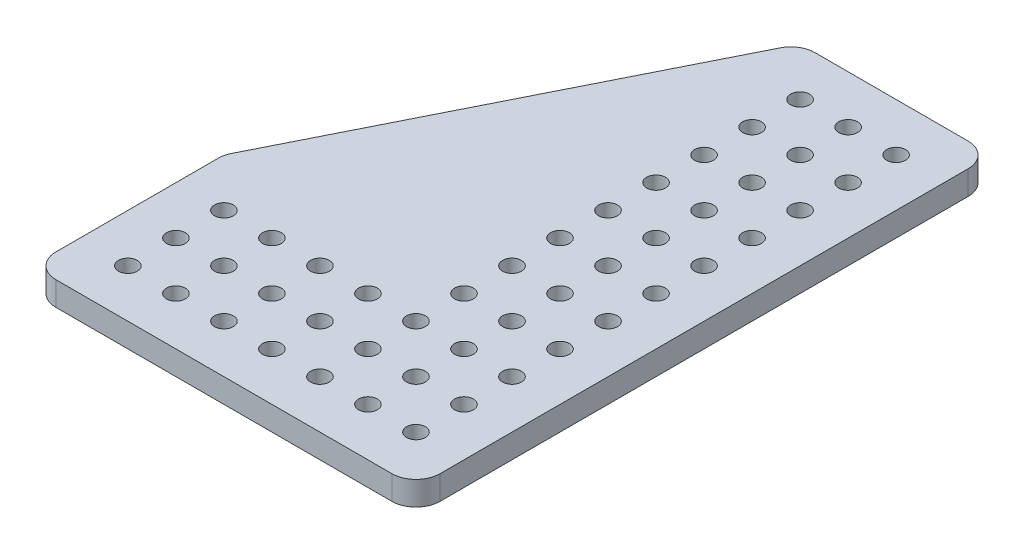
from build123d import *

# Parameters (mm, degrees)
BOSS_EXTRUDE1_DEPTH = 6.35
SKETCH2_R           = 2.4892
CUT_EXTRUDE1_DEPTH  = 184.272045059
FILLET1_R           = 6.35


with BuildPart() as part:
    # Sketch1 → Boss-Extrude1 (new body)
    with BuildSketch(Plane(origin=(0, 0, 0), x_dir=(1, 0, 0), z_dir=(0, 1, 0))):
        Polygon((0, 50.8), (50.8, 152.4), (101.6, 152.4), (101.6, 0), (0, 0), align=None)
    extrude(amount=BOSS_EXTRUDE1_DEPTH)

    # Sketch2 → Cut-Extrude1 (cut, through all)
    with BuildSketch(Plane(origin=(0, 6.35, 0), x_dir=(1, 0, 0), z_dir=(0, 1, 0))):
        with Locations((88.9, 12.7)):
            Circle(SKETCH2_R)
        with Locations((76.2, 12.7)):
            Circle(SKETCH2_R)
        with Locations((63.5, 12.7)):
            Circle(SKETCH2_R)
        with Locations((50.8, 12.7)):
            Circle(SKETCH2_R)
        with Locations((38.1, 12.7)):
            Circle(SKETCH2_R)
        with Locations((25.4, 12.7)):
            Circle(SKETCH2_R)
        with Locations((12.7, 12.7)):
            Circle(SKETCH2_R)
        with Locations((76.2, 25.4)):
            Circle(SKETCH2_R)
        with Locations((63.5, 25.4)):
            Circle(SKETCH2_R)
        with Locations((50.8, 25.4)):
            Circle(SKETCH2_R)
        with Locations((38.1, 25.4)):
            Circle(SKETCH2_R)
        with Locations((25.4, 25.4)):
            Circle(SKETCH2_R)
        with Locations((12.7, 25.4)):
            Circle(SKETCH2_R)
        with Locations((76.2, 38.1)):
            Circle(SKETCH2_R)
        with Locations((63.5, 38.1)):
            Circle(SKETCH2_R)
        with Locations((50.8, 38.1)):
            Circle(SKETCH2_R)
        with Locations((38.1, 38.1)):
            Circle(SKETCH2_R)
        with Locations((25.4, 38.1)):
            Circle(SKETCH2_R)
        with Locations((12.7, 38.1)):
            Circle(SKETCH2_R)
        with Locations((76.2, 50.8)):
            Circle(SKETCH2_R)
        with Locations((63.5, 50.8)):
            Circle(SKETCH2_R)
        with Locations((76.2, 63.5)):
            Circle(SKETCH2_R)
        with Locations((63.5, 63.5)):
            Circle(SKETCH2_R)
        with Locations((76.2, 76.2)):
            Circle(SKETCH2_R)
        with Locations((63.5, 76.2)):
            Circle(SKETCH2_R)
        with Locations((76.2, 88.9)):
            Circle(SKETCH2_R)
        with Locations((63.5, 88.9)):
            Circle(SKETCH2_R)
        with Locations((76.2, 101.6)):
            Circle(SKETCH2_R)
        with Locations((63.5, 101.6)):
            Circle(SKETCH2_R)
        with Locations((76.2, 114.3)):
            Circle(SKETCH2_R)
        with Locations((63.5, 114.3)):
            Circle(SKETCH2_R)
        with Locations((76.2, 127)):
            Circle(SKETCH2_R)
        with Locations((63.5, 127)):
            Circle(SKETCH2_R)
        with Locations((76.2, 139.7)):
            Circle(SKETCH2_R)
        with Locations((63.5, 139.7)):
            Circle(SKETCH2_R)
        with Locations((88.9, 25.4)):
            Circle(SKETCH2_R)
        with Locations((88.9, 38.1)):
            Circle(SKETCH2_R)
        with Locations((88.9, 50.8)):
            Circle(SKETCH2_R)
        with Locations((88.9, 63.5)):
            Circle(SKETCH2_R)
        with Locations((88.9, 76.2)):
            Circle(SKETCH2_R)
        with Locations((88.9, 88.9)):
            Circle(SKETCH2_R)
        with Locations((88.9, 101.6)):
            Circle(SKETCH2_R)
        with Locations((88.9, 114.3)):
            Circle(SKETCH2_R)
        with Locations((88.9, 127)):
            Circle(SKETCH2_R)
        with Locations((88.9, 139.7)):
            Circle(SKETCH2_R)
    extrude(amount=-CUT_EXTRUDE1_DEPTH, mode=Mode.SUBTRACT)

    # Fillet1
    fillet1_edges = [part.edges().sort_by_distance(p)[0] for p in [
        (0, 3.175, -50.8),
        (101.6, 3.175, -152.4),
        (101.6, 3.175, 0),
        (0, 3.175, 0),
        (50.8, 3.175, -152.4),
    ]]
    fillet(fillet1_edges, radius=FILLET1_R)


solid = part.part
